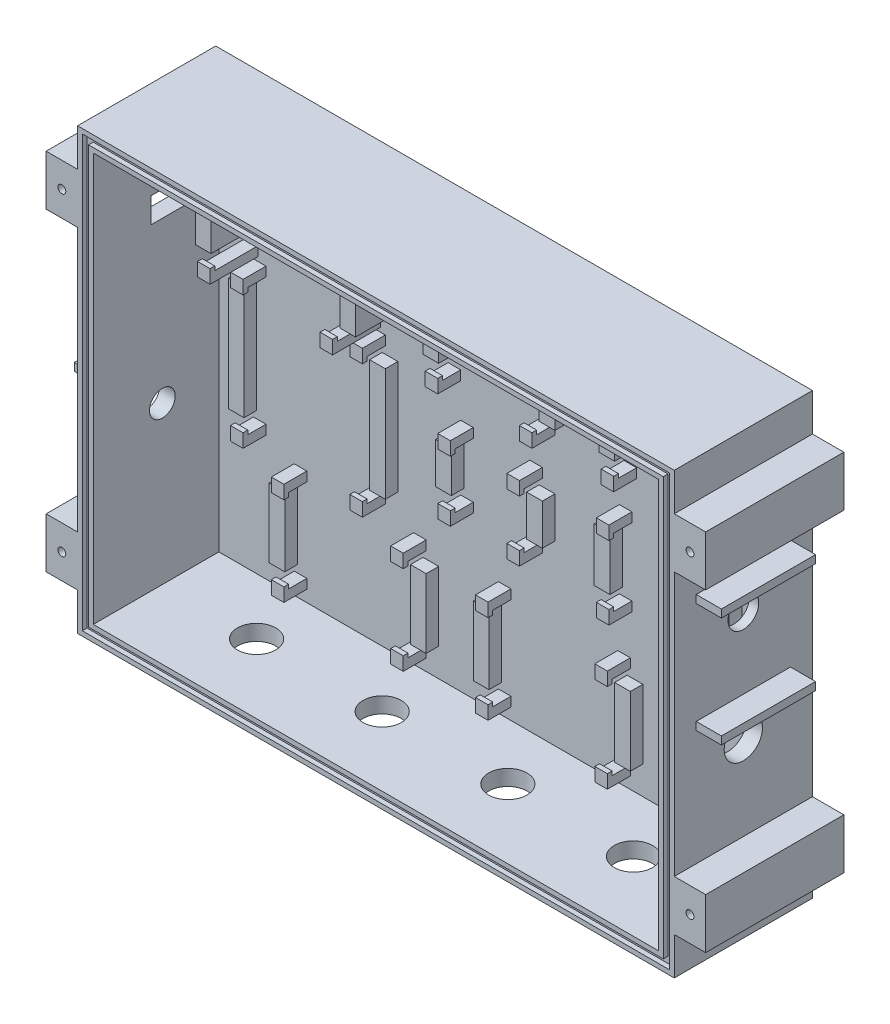
from build123d import *

# Parameters (mm, degrees)
SKETCH1_W                  = 190
SKETCH1_H                  = 140
BOX_SHELL_DEPTH            = 44
BOX_CAVITY_START           = 44
SKETCH2_W                  = 180
SKETCH2_H                  = 130
BOX_CAVITY_DEPTH           = 40
SKETCH3_W                  = 10
SKETCH3_H                  = 16
LID_LUGS_DEPTH             = 44
LID_SCREW_HOLES_M3_START   = 44
SKETCH4_R                  = 1.25
LID_SCREW_HOLES_M3_DEPTH   = 12
LID_GASKET_GROOVE_START    = 44
SKETCH5_W                  = 187
SKETCH5_H                  = 137
SKETCH5_W_2                = 183
SKETCH5_H_2                = 133
LID_GASKET_GROOVE_DEPTH    = 1.5
PADS_ESP32_START           = 4
SKETCH6_W                  = 5
SKETCH6_H                  = 24
PADS_ESP32_DEPTH           = 12
CLIP_POSTS_ESP32_START     = 4
SKETCH7_W                  = 4
SKETCH7_H                  = 3
CLIP_POSTS_ESP32_DEPTH     = 15.3
CLIP_LIPS_ESP32_START      = 17.8
SKETCH8_W                  = 4
SKETCH8_H                  = 1.3
CLIP_LIPS_ESP32_DEPTH      = 1.5
PADS_TDS_START             = 4
SKETCH9_W                  = 5
SKETCH9_H                  = 28
PADS_TDS_DEPTH             = 4
CLIP_POSTS_TDS_START       = 4
SKETCH10_W                 = 4
SKETCH10_H                 = 3
CLIP_POSTS_TDS_DEPTH       = 7.3
CLIP_LIPS_TDS_START        = 9.8
SKETCH11_W                 = 4
SKETCH11_H                 = 1.3
CLIP_LIPS_TDS_DEPTH        = 1.5
PADS_ORP_START             = 4
SKETCH12_W                 = 5
SKETCH12_H                 = 26
PADS_ORP_DEPTH             = 4
CLIP_POSTS_ORP_START       = 4
SKETCH13_W                 = 4
SKETCH13_H                 = 3
CLIP_POSTS_ORP_DEPTH       = 7.3
CLIP_LIPS_ORP_START        = 9.8
SKETCH14_W                 = 4
SKETCH14_H                 = 1.3
CLIP_LIPS_ORP_DEPTH        = 1.5
PADS_OPT_START             = 4
SKETCH15_W                 = 5
SKETCH15_H                 = 36
PADS_OPT_DEPTH             = 4
CLIP_POSTS_OPT_START       = 4
SKETCH16_W                 = 4
SKETCH16_H                 = 3
CLIP_POSTS_OPT_DEPTH       = 7.3
CLIP_LIPS_OPT_START        = 9.8
SKETCH17_W                 = 4
SKETCH17_H                 = 1.3
CLIP_LIPS_OPT_DEPTH        = 1.5
PADS_MOSFET_START          = 4
SKETCH18_W                 = 5
SKETCH18_H                 = 13
PADS_MOSFET_DEPTH          = 4
CLIP_POSTS_MOSFET_START    = 4
SKETCH19_W                 = 4
SKETCH19_H                 = 3
CLIP_POSTS_MOSFET_DEPTH    = 7.3
CLIP_LIPS_MOSFET_START     = 9.8
SKETCH20_W                 = 4
SKETCH20_H                 = 1.3
CLIP_LIPS_MOSFET_DEPTH     = 1.5
PADS_BUCK_START            = 4
SKETCH21_W                 = 5
SKETCH21_H                 = 17
PADS_BUCK_DEPTH            = 4
CLIP_POSTS_BUCK_START      = 4
SKETCH22_W                 = 4
SKETCH22_H                 = 3
CLIP_POSTS_BUCK_DEPTH      = 7.3
CLIP_LIPS_BUCK_START       = 9.8
SKETCH23_W                 = 4
SKETCH23_H                 = 1.3
CLIP_LIPS_BUCK_DEPTH       = 1.5
PADS_RELAY_RO_START        = 4
SKETCH24_W                 = 5
SKETCH24_H                 = 22
PADS_RELAY_RO_DEPTH        = 4
CLIP_POSTS_RELAY_RO_START  = 4
SKETCH25_W                 = 4
SKETCH25_H                 = 3
CLIP_POSTS_RELAY_RO_DEPTH  = 7.3
CLIP_LIPS_RELAY_RO_START   = 9.8
SKETCH26_W                 = 4
SKETCH26_H                 = 1.3
CLIP_LIPS_RELAY_RO_DEPTH   = 1.5
PADS_RELAY_BYP_START       = 4
SKETCH27_W                 = 5
SKETCH27_H                 = 22
PADS_RELAY_BYP_DEPTH       = 4
CLIP_POSTS_RELAY_BYP_START = 4
SKETCH28_W                 = 4
SKETCH28_H                 = 3
CLIP_POSTS_RELAY_BYP_DEPTH = 7.3
CLIP_LIPS_RELAY_BYP_START  = 9.8
SKETCH29_W                 = 4
SKETCH29_H                 = 1.3
CLIP_LIPS_RELAY_BYP_DEPTH  = 1.5
BOTTOM_GLAND_HOLES_START   = -70.2
SKETCH30_R                 = 6.1
BOTTOM_GLAND_HOLES_DEPTH   = 5.5
RIGHT_GLAND_HOLE_START     = 95.2
SKETCH31_R                 = 6.1
RIGHT_GLAND_HOLE_DEPTH     = 5.5
BNC_HOLE_START             = 95.2
SKETCH32_R                 = 4.9
BNC_HOLE_DEPTH             = 5.5
BNC_SPOT_FACE_START        = 90
SKETCH33_R                 = 8
BNC_SPOT_FACE_DEPTH        = 2
DC_JACK_HOLE_START         = -95.2
SKETCH34_R                 = 4.1
DC_JACK_HOLE_DEPTH         = 5.5
USB_SLOT_START             = -95.2
SKETCH35_W                 = 13
SKETCH35_H                 = 8
USB_SLOT_DEPTH             = 5.5
DRIP_LIPS_START            = 7
SKETCH36_W                 = 8
SKETCH36_H                 = 2.5
DRIP_LIPS_DEPTH            = 30
BOTTOM_DRIP_SHIELDS_START  = 31
SKETCH37_W                 = 18
SKETCH37_H                 = 8
BOTTOM_DRIP_SHIELDS_DEPTH  = 2.5


with BuildPart() as part:
    # Sketch1 → Box_Shell (new body)
    with BuildSketch(Plane.XY):
        Rectangle(SKETCH1_W, SKETCH1_H)
    extrude(amount=BOX_SHELL_DEPTH)

    # Sketch2 → Box_Cavity (cut)
    with BuildSketch(Plane.XY.offset(BOX_CAVITY_START)):
        Rectangle(SKETCH2_W, SKETCH2_H)
    extrude(amount=-BOX_CAVITY_DEPTH, mode=Mode.SUBTRACT)

    # Sketch3 → Lid_Lugs (add)
    with BuildSketch(Plane.XY):
        with Locations((-100, -50)):
            Rectangle(SKETCH3_W, SKETCH3_H)
        with Locations((-100, 50)):
            Rectangle(SKETCH3_W, SKETCH3_H)
        with Locations((100, -50)):
            Rectangle(SKETCH3_W, SKETCH3_H)
        with Locations((100, 50)):
            Rectangle(SKETCH3_W, SKETCH3_H)
    extrude(amount=LID_LUGS_DEPTH)

    # Sketch4 → Lid_Screw_Holes_M3 (cut)
    with BuildSketch(Plane.XY.offset(LID_SCREW_HOLES_M3_START)):
        with Locations((-100, -50)):
            Circle(SKETCH4_R)
        with Locations((-100, 50)):
            Circle(SKETCH4_R)
        with Locations((100, -50)):
            Circle(SKETCH4_R)
        with Locations((100, 50)):
            Circle(SKETCH4_R)
    extrude(amount=-LID_SCREW_HOLES_M3_DEPTH, mode=Mode.SUBTRACT)

    # Sketch5 → Lid_Gasket_Groove (cut)
    with BuildSketch(Plane.XY.offset(LID_GASKET_GROOVE_START)):
        Rectangle(SKETCH5_W, SKETCH5_H)
        Rectangle(SKETCH5_W_2, SKETCH5_H_2, mode=Mode.SUBTRACT)
    extrude(amount=-LID_GASKET_GROOVE_DEPTH, mode=Mode.SUBTRACT)

    # Sketch6 → Pads_ESP32 (add)
    with BuildSketch(Plane.XY.offset(PADS_ESP32_START)):
        with Locations((-83, 40)):
            Rectangle(SKETCH6_W, SKETCH6_H)
        with Locations((-37, 40)):
            Rectangle(SKETCH6_W, SKETCH6_H)
    extrude(amount=PADS_ESP32_DEPTH)

    # Sketch7 → Clip_Posts_ESP32 (add)
    with BuildSketch(Plane.XY.offset(CLIP_POSTS_ESP32_START)):
        with Locations((-79.5, 24.2)):
            Rectangle(SKETCH7_W, SKETCH7_H)
        with Locations((-79.5, 55.8)):
            Rectangle(SKETCH7_W, SKETCH7_H)
        with Locations((-40.5, 24.2)):
            Rectangle(SKETCH7_W, SKETCH7_H)
        with Locations((-40.5, 55.8)):
            Rectangle(SKETCH7_W, SKETCH7_H)
    extrude(amount=CLIP_POSTS_ESP32_DEPTH)

    # Sketch8 → Clip_Lips_ESP32 (add)
    with BuildSketch(Plane.XY.offset(CLIP_LIPS_ESP32_START)):
        with Locations((-79.5, 26.35)):
            Rectangle(SKETCH8_W, SKETCH8_H)
        with Locations((-79.5, 53.65)):
            Rectangle(SKETCH8_W, SKETCH8_H)
        with Locations((-40.5, 26.35)):
            Rectangle(SKETCH8_W, SKETCH8_H)
        with Locations((-40.5, 53.65)):
            Rectangle(SKETCH8_W, SKETCH8_H)
    extrude(amount=CLIP_LIPS_ESP32_DEPTH)

    # Sketch9 → Pads_TDS (add)
    with BuildSketch(Plane.XY.offset(PADS_TDS_START)):
        with Locations((-18.5, 40)):
            Rectangle(SKETCH9_W, SKETCH9_H)
        with Locations((18.5, 40)):
            Rectangle(SKETCH9_W, SKETCH9_H)
    extrude(amount=PADS_TDS_DEPTH)

    # Sketch10 → Clip_Posts_TDS (add)
    with BuildSketch(Plane.XY.offset(CLIP_POSTS_TDS_START)):
        with Locations((-15, 22.2)):
            Rectangle(SKETCH10_W, SKETCH10_H)
        with Locations((-15, 57.8)):
            Rectangle(SKETCH10_W, SKETCH10_H)
        with Locations((15, 22.2)):
            Rectangle(SKETCH10_W, SKETCH10_H)
        with Locations((15, 57.8)):
            Rectangle(SKETCH10_W, SKETCH10_H)
    extrude(amount=CLIP_POSTS_TDS_DEPTH)

    # Sketch11 → Clip_Lips_TDS (add)
    with BuildSketch(Plane.XY.offset(CLIP_LIPS_TDS_START)):
        with Locations((-15, 24.35)):
            Rectangle(SKETCH11_W, SKETCH11_H)
        with Locations((-15, 55.65)):
            Rectangle(SKETCH11_W, SKETCH11_H)
        with Locations((15, 24.35)):
            Rectangle(SKETCH11_W, SKETCH11_H)
        with Locations((15, 55.65)):
            Rectangle(SKETCH11_W, SKETCH11_H)
    extrude(amount=CLIP_LIPS_TDS_DEPTH)

    # Sketch12 → Pads_ORP (add)
    with BuildSketch(Plane.XY.offset(PADS_ORP_START)):
        with Locations((37.5, 40)):
            Rectangle(SKETCH12_W, SKETCH12_H)
        with Locations((72.5, 40)):
            Rectangle(SKETCH12_W, SKETCH12_H)
    extrude(amount=PADS_ORP_DEPTH)

    # Sketch13 → Clip_Posts_ORP (add)
    with BuildSketch(Plane.XY.offset(CLIP_POSTS_ORP_START)):
        with Locations((41, 23.2)):
            Rectangle(SKETCH13_W, SKETCH13_H)
        with Locations((41, 56.8)):
            Rectangle(SKETCH13_W, SKETCH13_H)
        with Locations((69, 23.2)):
            Rectangle(SKETCH13_W, SKETCH13_H)
        with Locations((69, 56.8)):
            Rectangle(SKETCH13_W, SKETCH13_H)
    extrude(amount=CLIP_POSTS_ORP_DEPTH)

    # Sketch14 → Clip_Lips_ORP (add)
    with BuildSketch(Plane.XY.offset(CLIP_LIPS_ORP_START)):
        with Locations((41, 25.35)):
            Rectangle(SKETCH14_W, SKETCH14_H)
        with Locations((41, 54.65)):
            Rectangle(SKETCH14_W, SKETCH14_H)
        with Locations((69, 25.35)):
            Rectangle(SKETCH14_W, SKETCH14_H)
        with Locations((69, 54.65)):
            Rectangle(SKETCH14_W, SKETCH14_H)
    extrude(amount=CLIP_LIPS_ORP_DEPTH)

    # Sketch15 → Pads_OPT (add)
    with BuildSketch(Plane.XY.offset(PADS_OPT_START)):
        with Locations((-80.5, -2)):
            Rectangle(SKETCH15_W, SKETCH15_H)
        with Locations((-35.5, -2)):
            Rectangle(SKETCH15_W, SKETCH15_H)
    extrude(amount=PADS_OPT_DEPTH)

    # Sketch16 → Clip_Posts_OPT (add)
    with BuildSketch(Plane.XY.offset(CLIP_POSTS_OPT_START)):
        with Locations((-77, -23.8)):
            Rectangle(SKETCH16_W, SKETCH16_H)
        with Locations((-77, 19.8)):
            Rectangle(SKETCH16_W, SKETCH16_H)
        with Locations((-39, -23.8)):
            Rectangle(SKETCH16_W, SKETCH16_H)
        with Locations((-39, 19.8)):
            Rectangle(SKETCH16_W, SKETCH16_H)
    extrude(amount=CLIP_POSTS_OPT_DEPTH)

    # Sketch17 → Clip_Lips_OPT (add)
    with BuildSketch(Plane.XY.offset(CLIP_LIPS_OPT_START)):
        with Locations((-77, -21.65)):
            Rectangle(SKETCH17_W, SKETCH17_H)
        with Locations((-77, 17.65)):
            Rectangle(SKETCH17_W, SKETCH17_H)
        with Locations((-39, -21.65)):
            Rectangle(SKETCH17_W, SKETCH17_H)
        with Locations((-39, 17.65)):
            Rectangle(SKETCH17_W, SKETCH17_H)
    extrude(amount=CLIP_LIPS_OPT_DEPTH)

    # Sketch18 → Pads_MOSFET (add)
    with BuildSketch(Plane.XY.offset(PADS_MOSFET_START)):
        with Locations((-14.5, -2)):
            Rectangle(SKETCH18_W, SKETCH18_H)
        with Locations((14.5, -2)):
            Rectangle(SKETCH18_W, SKETCH18_H)
    extrude(amount=PADS_MOSFET_DEPTH)

    # Sketch19 → Clip_Posts_MOSFET (add)
    with BuildSketch(Plane.XY.offset(CLIP_POSTS_MOSFET_START)):
        with Locations((-11, -12.3)):
            Rectangle(SKETCH19_W, SKETCH19_H)
        with Locations((-11, 8.3)):
            Rectangle(SKETCH19_W, SKETCH19_H)
        with Locations((11, -12.3)):
            Rectangle(SKETCH19_W, SKETCH19_H)
        with Locations((11, 8.3)):
            Rectangle(SKETCH19_W, SKETCH19_H)
    extrude(amount=CLIP_POSTS_MOSFET_DEPTH)

    # Sketch20 → Clip_Lips_MOSFET (add)
    with BuildSketch(Plane.XY.offset(CLIP_LIPS_MOSFET_START)):
        with Locations((-11, -10.15)):
            Rectangle(SKETCH20_W, SKETCH20_H)
        with Locations((-11, 6.15)):
            Rectangle(SKETCH20_W, SKETCH20_H)
        with Locations((11, -10.15)):
            Rectangle(SKETCH20_W, SKETCH20_H)
        with Locations((11, 6.15)):
            Rectangle(SKETCH20_W, SKETCH20_H)
    extrude(amount=CLIP_LIPS_MOSFET_DEPTH)

    # Sketch21 → Pads_BUCK (add)
    with BuildSketch(Plane.XY.offset(PADS_BUCK_START)):
        with Locations((36, -2)):
            Rectangle(SKETCH21_W, SKETCH21_H)
        with Locations((74, -2)):
            Rectangle(SKETCH21_W, SKETCH21_H)
    extrude(amount=PADS_BUCK_DEPTH)

    # Sketch22 → Clip_Posts_BUCK (add)
    with BuildSketch(Plane.XY.offset(CLIP_POSTS_BUCK_START)):
        with Locations((39.5, -14.3)):
            Rectangle(SKETCH22_W, SKETCH22_H)
        with Locations((39.5, 10.3)):
            Rectangle(SKETCH22_W, SKETCH22_H)
        with Locations((70.5, -14.3)):
            Rectangle(SKETCH22_W, SKETCH22_H)
        with Locations((70.5, 10.3)):
            Rectangle(SKETCH22_W, SKETCH22_H)
    extrude(amount=CLIP_POSTS_BUCK_DEPTH)

    # Sketch23 → Clip_Lips_BUCK (add)
    with BuildSketch(Plane.XY.offset(CLIP_LIPS_BUCK_START)):
        with Locations((39.5, -12.15)):
            Rectangle(SKETCH23_W, SKETCH23_H)
        with Locations((39.5, 8.15)):
            Rectangle(SKETCH23_W, SKETCH23_H)
        with Locations((70.5, -12.15)):
            Rectangle(SKETCH23_W, SKETCH23_H)
        with Locations((70.5, 8.15)):
            Rectangle(SKETCH23_W, SKETCH23_H)
    extrude(amount=CLIP_LIPS_BUCK_DEPTH)

    # Sketch24 → Pads_RELAY_RO (add)
    with BuildSketch(Plane.XY.offset(PADS_RELAY_RO_START)):
        with Locations((-67.5, -45)):
            Rectangle(SKETCH24_W, SKETCH24_H)
        with Locations((-22.5, -45)):
            Rectangle(SKETCH24_W, SKETCH24_H)
    extrude(amount=PADS_RELAY_RO_DEPTH)

    # Sketch25 → Clip_Posts_RELAY_RO (add)
    with BuildSketch(Plane.XY.offset(CLIP_POSTS_RELAY_RO_START)):
        with Locations((-64, -59.8)):
            Rectangle(SKETCH25_W, SKETCH25_H)
        with Locations((-64, -30.2)):
            Rectangle(SKETCH25_W, SKETCH25_H)
        with Locations((-26, -59.8)):
            Rectangle(SKETCH25_W, SKETCH25_H)
        with Locations((-26, -30.2)):
            Rectangle(SKETCH25_W, SKETCH25_H)
    extrude(amount=CLIP_POSTS_RELAY_RO_DEPTH)

    # Sketch26 → Clip_Lips_RELAY_RO (add)
    with BuildSketch(Plane.XY.offset(CLIP_LIPS_RELAY_RO_START)):
        with Locations((-64, -57.65)):
            Rectangle(SKETCH26_W, SKETCH26_H)
        with Locations((-64, -32.35)):
            Rectangle(SKETCH26_W, SKETCH26_H)
        with Locations((-26, -57.65)):
            Rectangle(SKETCH26_W, SKETCH26_H)
        with Locations((-26, -32.35)):
            Rectangle(SKETCH26_W, SKETCH26_H)
    extrude(amount=CLIP_LIPS_RELAY_RO_DEPTH)

    # Sketch27 → Pads_RELAY_BYP (add)
    with BuildSketch(Plane.XY.offset(PADS_RELAY_BYP_START)):
        with Locations((-2.5, -45)):
            Rectangle(SKETCH27_W, SKETCH27_H)
        with Locations((42.5, -45)):
            Rectangle(SKETCH27_W, SKETCH27_H)
    extrude(amount=PADS_RELAY_BYP_DEPTH)

    # Sketch28 → Clip_Posts_RELAY_BYP (add)
    with BuildSketch(Plane.XY.offset(CLIP_POSTS_RELAY_BYP_START)):
        with Locations((1, -59.8)):
            Rectangle(SKETCH28_W, SKETCH28_H)
        with Locations((1, -30.2)):
            Rectangle(SKETCH28_W, SKETCH28_H)
        with Locations((39, -59.8)):
            Rectangle(SKETCH28_W, SKETCH28_H)
        with Locations((39, -30.2)):
            Rectangle(SKETCH28_W, SKETCH28_H)
    extrude(amount=CLIP_POSTS_RELAY_BYP_DEPTH)

    # Sketch29 → Clip_Lips_RELAY_BYP (add)
    with BuildSketch(Plane.XY.offset(CLIP_LIPS_RELAY_BYP_START)):
        with Locations((1, -57.65)):
            Rectangle(SKETCH29_W, SKETCH29_H)
        with Locations((1, -32.35)):
            Rectangle(SKETCH29_W, SKETCH29_H)
        with Locations((39, -57.65)):
            Rectangle(SKETCH29_W, SKETCH29_H)
        with Locations((39, -32.35)):
            Rectangle(SKETCH29_W, SKETCH29_H)
    extrude(amount=CLIP_LIPS_RELAY_BYP_DEPTH)

    # Sketch30 → Bottom_Gland_Holes (cut)
    with BuildSketch(Plane(origin=(0, 0, 0), x_dir=(1, 0, 0), z_dir=(0, 1, 0)).offset(BOTTOM_GLAND_HOLES_START)):
        with Locations((-60, -22)):
            Circle(SKETCH30_R)
        with Locations((-20, -22)):
            Circle(SKETCH30_R)
        with Locations((20, -22)):
            Circle(SKETCH30_R)
        with Locations((60, -22)):
            Circle(SKETCH30_R)
    extrude(amount=BOTTOM_GLAND_HOLES_DEPTH, mode=Mode.SUBTRACT)

    # Sketch31 → Right_Gland_Hole (cut)
    with BuildSketch(Plane(origin=(0, 0, 0), x_dir=(0, 0, -1), z_dir=(1, 0, 0)).offset(RIGHT_GLAND_HOLE_START)):
        with Locations((-22, -15)):
            Circle(SKETCH31_R)
    extrude(amount=-RIGHT_GLAND_HOLE_DEPTH, mode=Mode.SUBTRACT)

    # Sketch32 → BNC_Hole (cut)
    with BuildSketch(Plane(origin=(0, 0, 0), x_dir=(0, 0, -1), z_dir=(1, 0, 0)).offset(BNC_HOLE_START)):
        with Locations((-22, 20)):
            Circle(SKETCH32_R)
    extrude(amount=-BNC_HOLE_DEPTH, mode=Mode.SUBTRACT)

    # Sketch33 → BNC_Spot_Face (cut)
    with BuildSketch(Plane(origin=(0, 0, 0), x_dir=(0, 0, -1), z_dir=(1, 0, 0)).offset(BNC_SPOT_FACE_START)):
        with Locations((-22, 20)):
            Circle(SKETCH33_R)
    extrude(amount=BNC_SPOT_FACE_DEPTH, mode=Mode.SUBTRACT)

    # Sketch34 → DC_Jack_Hole (cut)
    with BuildSketch(Plane(origin=(0, 0, 0), x_dir=(0, 0, -1), z_dir=(1, 0, 0)).offset(DC_JACK_HOLE_START)):
        with Locations((-22, -15)):
            Circle(SKETCH34_R)
    extrude(amount=DC_JACK_HOLE_DEPTH, mode=Mode.SUBTRACT)

    # Sketch35 → USB_Slot (cut)
    with BuildSketch(Plane(origin=(0, 0, 0), x_dir=(0, 0, -1), z_dir=(1, 0, 0)).offset(USB_SLOT_START)):
        with Locations((-19.1, 40)):
            Rectangle(SKETCH35_W, SKETCH35_H)
    extrude(amount=USB_SLOT_DEPTH, mode=Mode.SUBTRACT)

    # Sketch36 → Drip_Lips (add)
    with BuildSketch(Plane.XY.offset(DRIP_LIPS_START)):
        with Locations((99, -4)):
            Rectangle(SKETCH36_W, SKETCH36_H)
        with Locations((99, 31)):
            Rectangle(SKETCH36_W, SKETCH36_H)
        with Locations((-99, -4)):
            Rectangle(SKETCH36_W, SKETCH36_H)
        with Locations((-99, 51)):
            Rectangle(SKETCH36_W, SKETCH36_H)
    extrude(amount=DRIP_LIPS_DEPTH)

    # Sketch37 → Bottom_Drip_Shields (add)
    with BuildSketch(Plane.XY.offset(BOTTOM_DRIP_SHIELDS_START)):
        with Locations((-60, -74)):
            Rectangle(SKETCH37_W, SKETCH37_H)
        with Locations((-20, -74)):
            Rectangle(SKETCH37_W, SKETCH37_H)
        with Locations((20, -74)):
            Rectangle(SKETCH37_W, SKETCH37_H)
        with Locations((60, -74)):
            Rectangle(SKETCH37_W, SKETCH37_H)
    extrude(amount=BOTTOM_DRIP_SHIELDS_DEPTH)


solid = part.part
